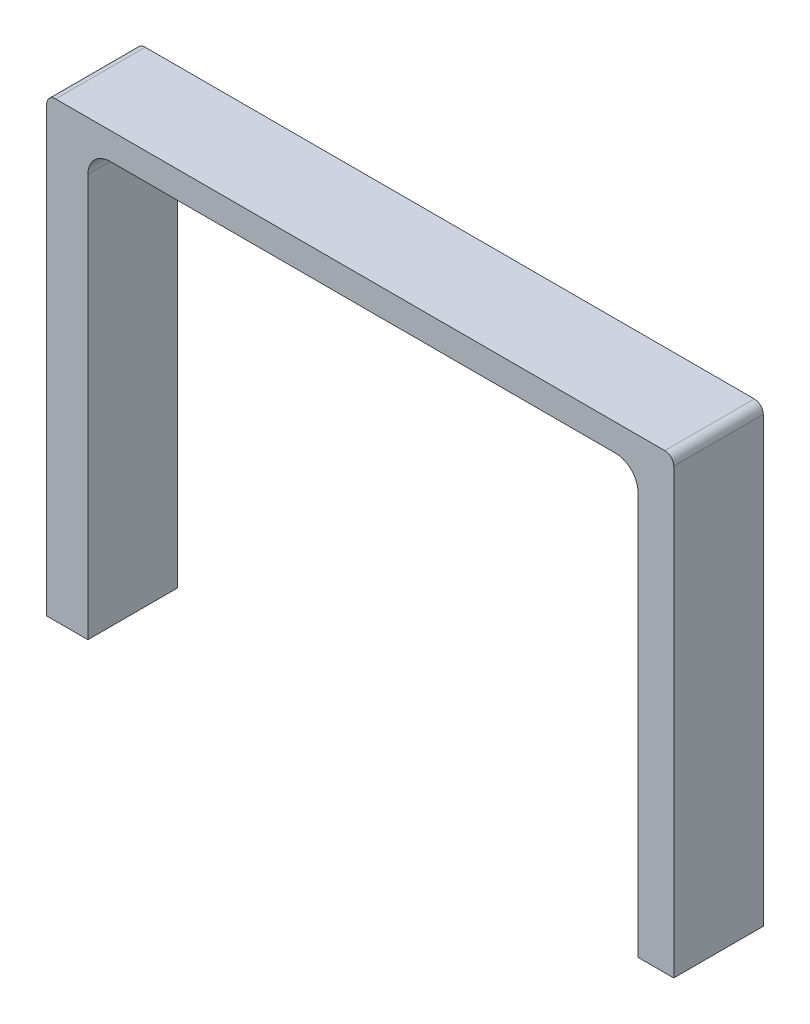
from build123d import *

# Parameters (mm, degrees)
BOSS_EXTRUDE1_DEPTH = 25.4
FILLET1_R           = 6.35
FILLET2_R           = 2.54


with BuildPart() as part:
    # Sketch1 → Boss-Extrude1 (new body)
    with BuildSketch(Plane.XY):
        Polygon((78.7654, -64.135), (88.9254, -64.135), (88.9254, 64.135), (-88.9254, 64.135), (-88.9254, -64.135), (-77.2414, -64.135), (-77.2414, 56.515), (78.7654, 56.515), align=None)
    extrude(amount=BOSS_EXTRUDE1_DEPTH)

    # Fillet1
    fillet1_edges = [part.edges().sort_by_distance(p)[0] for p in [
        (-77.2414, 56.515, 12.7),
        (78.7654, 56.515, 12.7),
    ]]
    fillet(fillet1_edges, radius=FILLET1_R)

    # Fillet2
    fillet2_edges = [part.edges().sort_by_distance(p)[0] for p in [
        (-88.9254, 64.135, 12.7),
        (88.9254, 64.135, 12.7),
    ]]
    fillet(fillet2_edges, radius=FILLET2_R)


solid = part.part
